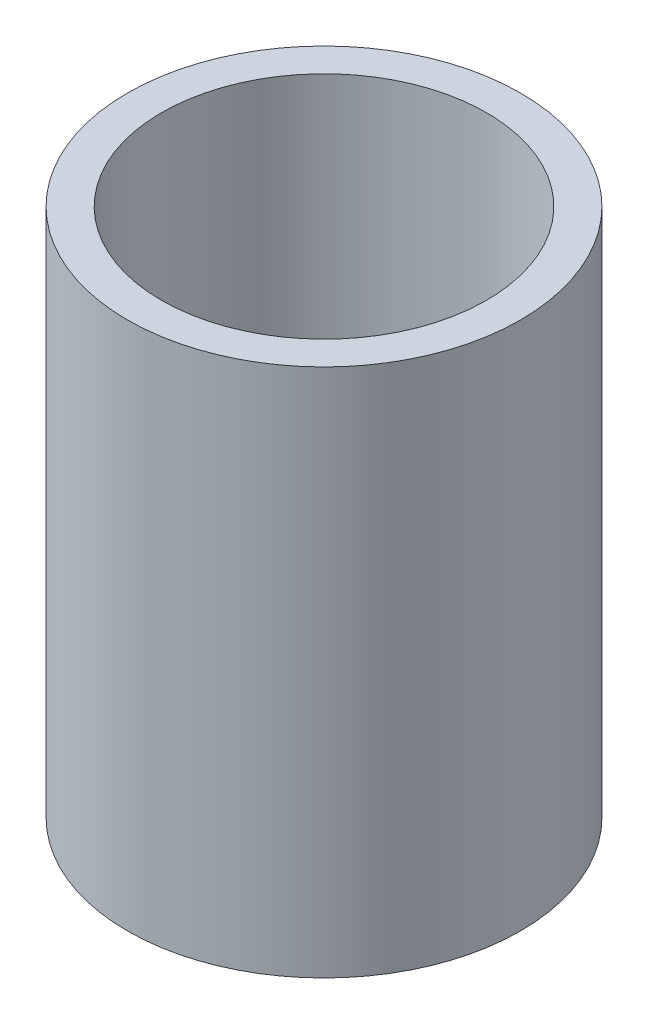
from build123d import *

# Parameters (mm, degrees)
SKETCH1_R           = 13
SKETCH1_R_2         = 10.75
BOSS_EXTRUDE1_DEPTH = 35


with BuildPart() as part:
    # Sketch1 → Boss-Extrude1 (new body)
    with BuildSketch(Plane(origin=(0, 0, 0), x_dir=(1, 0, 0), z_dir=(0, 1, 0))):
        Circle(SKETCH1_R)
        Circle(SKETCH1_R_2, mode=Mode.SUBTRACT)
    extrude(amount=BOSS_EXTRUDE1_DEPTH)


solid = part.part
